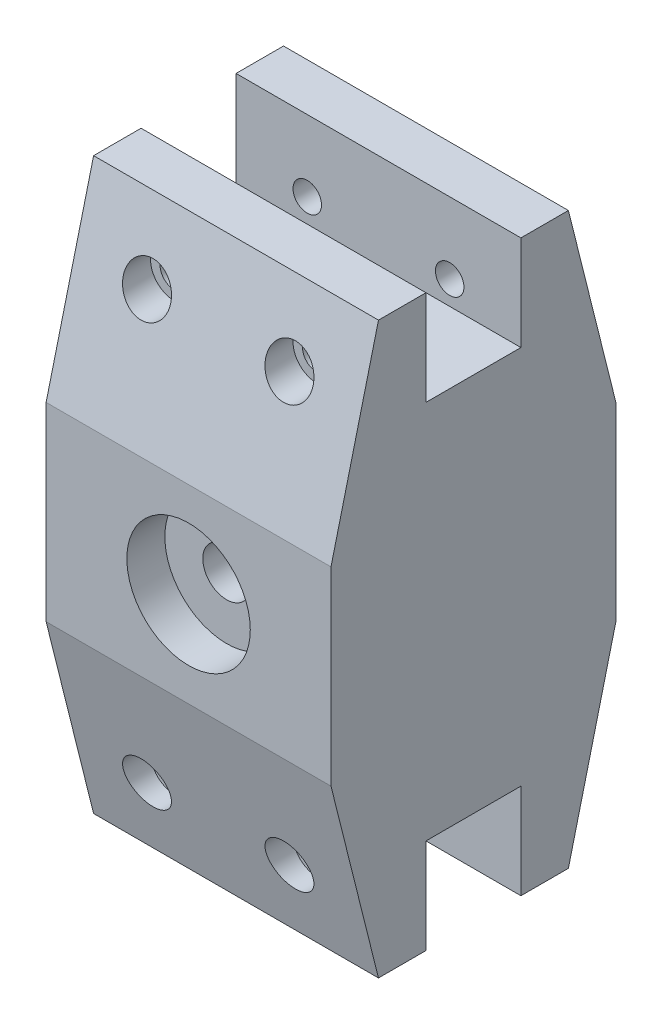
from build123d import *

# Parameters (mm, degrees)
BOSS_EXTRUDE1_DEPTH = 60
SKETCH3_R           = 5
CUT_EXTRUDE1_DEPTH  = 70
SKETCH4_R           = 13
CUT_EXTRUDE2_DEPTH  = 8
SKETCH5_R           = 3
CUT_EXTRUDE3_DEPTH  = 147.969384567
SKETCH6_R           = 5
CUT_EXTRUDE4_DEPTH  = 12


with BuildPart() as part:
    # Sketch2 → Boss-Extrude1 (new body)
    with BuildSketch(Plane(origin=(0, 0, 0), x_dir=(0, 0, -1), z_dir=(1, 0, 0))):
        Polygon((0, 40), (10, 0), (20, 0), (20, 20), (40, 20), (40, 0), (50, 0), (60, 40), (60, 80), (50, 120), (40, 120), (40, 100), (20, 100), (20, 120), (10, 120), (0, 80), align=None)
    extrude(amount=BOSS_EXTRUDE1_DEPTH)

    # Sketch3 → Cut-Extrude1 (cut)
    with BuildSketch(Plane.XY):
        with Locations((30, 60)):
            Circle(SKETCH3_R)
    extrude(amount=-CUT_EXTRUDE1_DEPTH, mode=Mode.SUBTRACT)

    # Sketch4 → Cut-Extrude2 (cut)
    with BuildSketch(Plane.XY):
        with Locations((30, 60)):
            Circle(SKETCH4_R)
    cut_extrude2 = extrude(amount=-CUT_EXTRUDE2_DEPTH, mode=Mode.SUBTRACT)

    # Mirror1: Cut-Extrude2 across plane
    add(cut_extrude2.mirror(Plane.XY.offset(-30)), mode=Mode.SUBTRACT)

    # Sketch5 → Cut-Extrude3 (cut, through all)
    with BuildSketch(Plane.XY):
        with Locations((45, 105)):
            Circle(SKETCH5_R)
        with Locations((15, 105)):
            Circle(SKETCH5_R)
        with Locations((45, 15)):
            Circle(SKETCH5_R)
        with Locations((15, 15)):
            Circle(SKETCH5_R)
    extrude(amount=-CUT_EXTRUDE3_DEPTH, mode=Mode.SUBTRACT)

    # Sketch6 → Cut-Extrude4 (cut)
    with BuildSketch(Plane.XY):
        with Locations((45, 105)):
            Circle(SKETCH6_R)
        with Locations((15, 105)):
            Circle(SKETCH6_R)
        with Locations((15, 15)):
            Circle(SKETCH6_R)
        with Locations((45, 15)):
            Circle(SKETCH6_R)
    cut_extrude4 = extrude(amount=-CUT_EXTRUDE4_DEPTH, mode=Mode.SUBTRACT)

    # Mirror2: Cut-Extrude4 across plane
    add(cut_extrude4.mirror(Plane.XY.offset(-30)), mode=Mode.SUBTRACT)


solid = part.part
